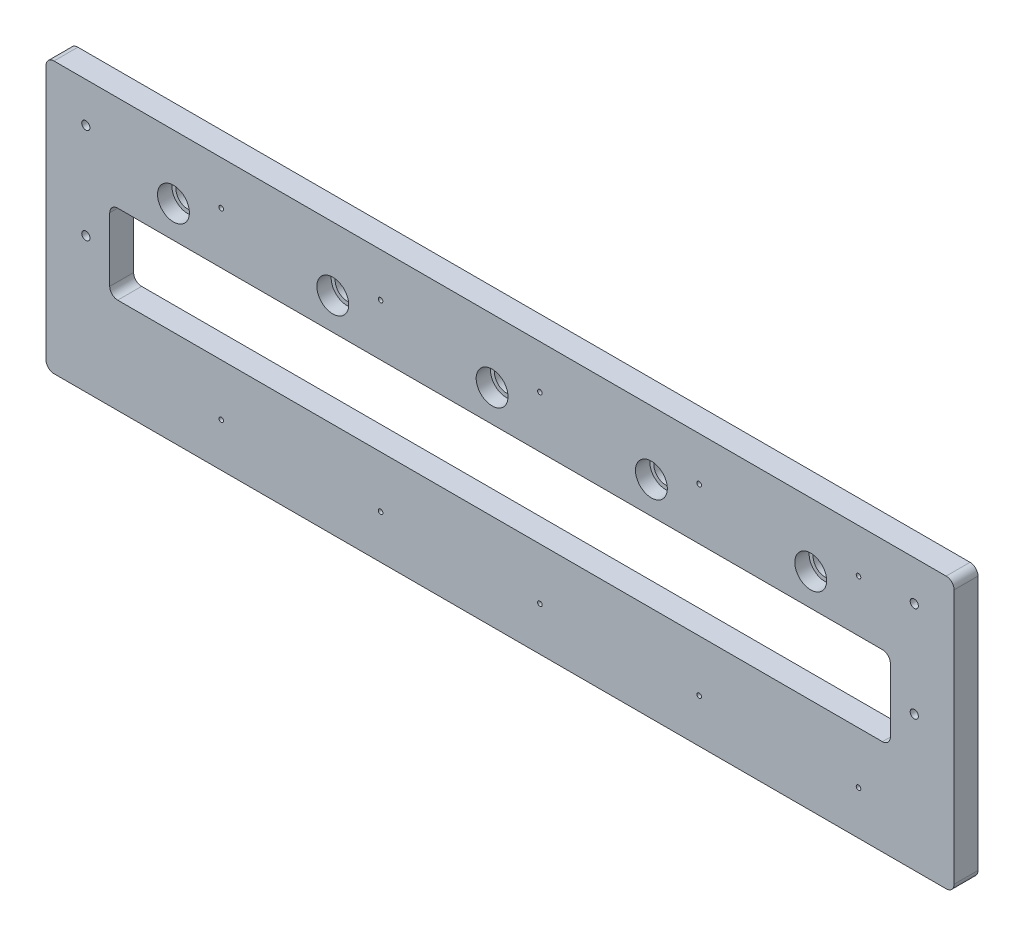
from build123d import *

# Parameters (mm, degrees)
SKETCH2_W                   = 723.9
SKETCH2_H                   = 215.9
BOSS_EXTRUDE1_DEPTH         = 19.05
CUT_EXTRUDE3_DEPTH          = 409.675659906
F_27_0_144_DIAMETER_HOLE1_D = 3.6576
F_1_4_CLEARANCE_HOLE1_D     = 6.5278
FILLET1_R                   = 6.35
SKETCH20_R                  = 9.525
CUT_EXTRUDE4_DEPTH          = 409.675659906
SKETCH21_R                  = 12.7
CUT_EXTRUDE5_DEPTH          = 11.43
LPATTERN1_COUNT             = 5
LPATTERN1_PITCH             = 127


with BuildPart() as part:
    # Sketch2 → Boss-Extrude1 (new body)
    with BuildSketch(Plane.XY):
        with Locations((-31.75, 0)):
            Rectangle(SKETCH2_W, SKETCH2_H)
    extrude(amount=BOSS_EXTRUDE1_DEPTH)

    # Sketch13 → Cut-Extrude3 (cut, through all)
    with BuildSketch(Plane.XY.offset(19.05)):
        with BuildLine():
            Line((-336.55, -31.75), (273.05, -31.75))
            ThreePointArc((273.05, -31.75), (277.540128061, -29.890128061), (279.4, -25.4))
            Line((279.4, -25.4), (279.4, 25.4))
            ThreePointArc((279.4, 25.4), (277.540128061, 29.890128061), (273.05, 31.75))
            Line((273.05, 31.75), (-336.55, 31.75))
            ThreePointArc((-336.55, 31.75), (-341.040128061, 29.890128061), (-342.9, 25.4))
            Line((-342.9, 25.4), (-342.9, -25.4))
            ThreePointArc((-342.9, -25.4), (-341.040128061, -29.890128061), (-336.55, -31.75))
        make_face()
    extrude(amount=-CUT_EXTRUDE3_DEPTH, mode=Mode.SUBTRACT)

    # #27 (0.144) Diameter Hole1 (through all)
    with Locations(Plane(origin=(0, 0, 0), x_dir=(-1, 0, 0), z_dir=(0, 0, -1))):
        with Locations((0, 0), (-254, 73.025), (-127, 73.025), (0, 73.025), (127, 73.025), (254, 73.025), (-127, -73.025), (0, -73.025), (127, -73.025), (254, -73.025), (-254, -73.025)):
            Hole(F_27_0_144_DIAMETER_HOLE1_D / 2)

    # 1/4 Clearance Hole1 (through all)
    with Locations(Plane(origin=(0, 0, 0), x_dir=(-1, 0, 0), z_dir=(0, 0, -1))):
        with Locations((-298.45, 76.2), (361.95, 76.2), (361.95, 0), (-298.45, 0)):
            Hole(F_1_4_CLEARANCE_HOLE1_D / 2)

    # Fillet1
    fillet1_edges = [part.edges().sort_by_distance(p)[0] for p in [
        (330.2, 107.95, 9.525),
        (330.2, -107.95, 9.525),
        (-393.7, -107.95, 9.525),
        (-393.7, 107.95, 9.525),
    ]]
    fillet(fillet1_edges, radius=FILLET1_R)

    # Sketch20 → Cut-Extrude4 (cut, through all)
    with BuildSketch(Plane(origin=(0, 0, 0), x_dir=(-1, 0, 0), z_dir=(0, 0, -1))):
        with Locations((-215.9, 57.15)):
            Circle(SKETCH20_R)
    cut_extrude4 = extrude(amount=-CUT_EXTRUDE4_DEPTH, mode=Mode.SUBTRACT)

    # Sketch21 → Cut-Extrude5 (cut)
    with BuildSketch(Plane.XY.offset(19.05)):
        with Locations((215.9, 57.15)):
            Circle(SKETCH21_R)
    cut_extrude5 = extrude(amount=-CUT_EXTRUDE5_DEPTH, mode=Mode.SUBTRACT)

    # LPattern1: Cut-Extrude4, Cut-Extrude5 ×5
    with Locations(*[(-i * LPATTERN1_PITCH, 0, 0) for i in range(1, LPATTERN1_COUNT)]):
        add(cut_extrude4, mode=Mode.SUBTRACT)
        add(cut_extrude5, mode=Mode.SUBTRACT)


solid = part.part
